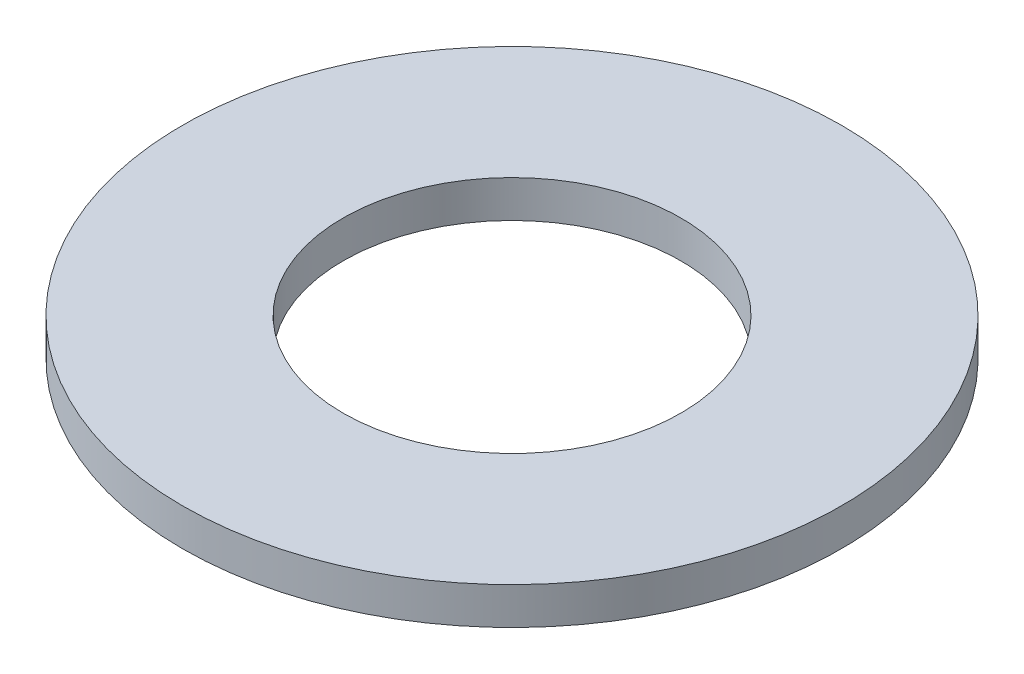
from build123d import *

# Parameters (mm, degrees)
SKETCH1_R           = 97.5
BOSS_EXTRUDE1_DEPTH = 11
SKETCH2_R           = 50
CUT_EXTRUDE1_DEPTH  = 139.32389526


with BuildPart() as part:
    # Sketch1 → Boss-Extrude1 (new body)
    with BuildSketch(Plane(origin=(0, 0, 0), x_dir=(1, 0, 0), z_dir=(0, 1, 0))):
        Circle(SKETCH1_R)
    extrude(amount=BOSS_EXTRUDE1_DEPTH)

    # Sketch2 → Cut-Extrude1 (cut, through all)
    with BuildSketch(Plane(origin=(0, 0, 0), x_dir=(1, 0, 0), z_dir=(0, 1, 0))):
        Circle(SKETCH2_R)
    extrude(amount=CUT_EXTRUDE1_DEPTH, mode=Mode.SUBTRACT)


solid = part.part
